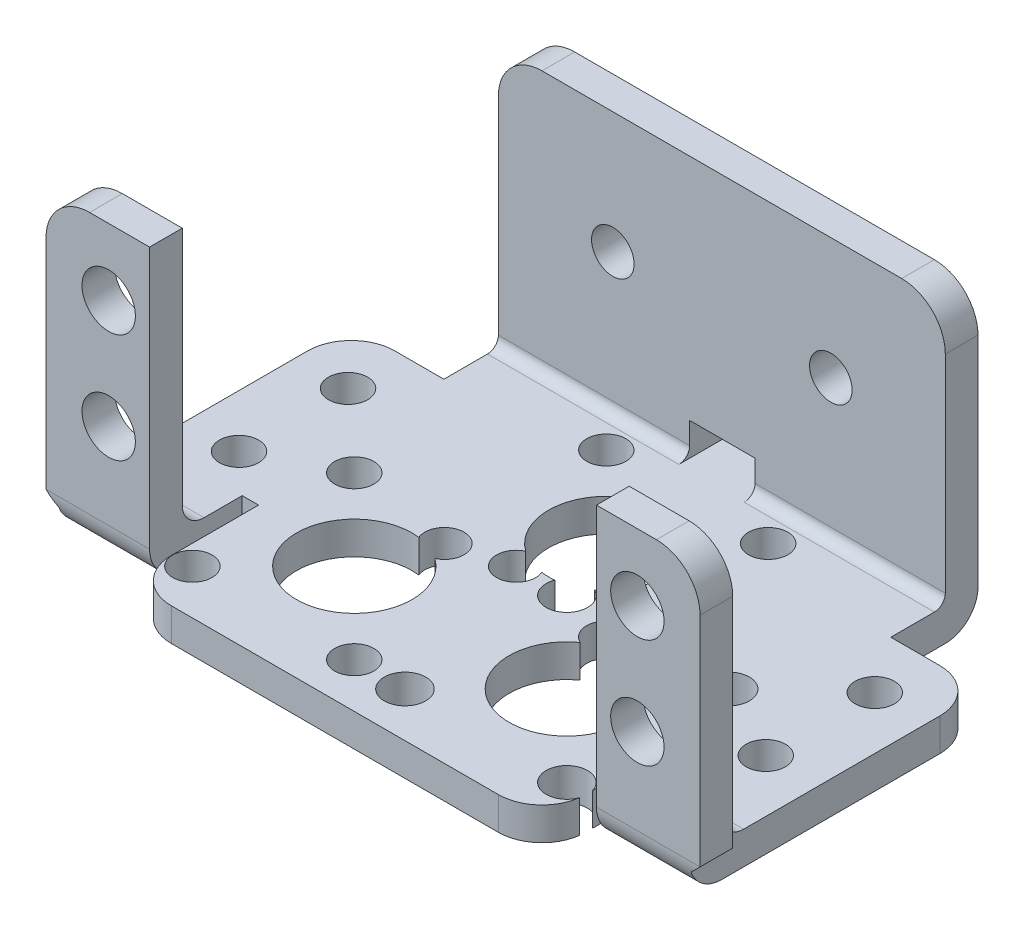
from build123d import *

# Parameters (mm, degrees)
CROQUIS1_W              = 41
CROQUIS1_H              = 23.5
CROQUIS1_R              = 5.3
SALIENTE_EXTRUIR1_DEPTH = 3
CROQUIS3_W              = 41
CROQUIS3_H              = 3
SALIENTE_EXTRUIR2_DEPTH = 27
CROQUIS4_R              = 1.8
SALIENTE_EXTRUIR3_DEPTH = 3
CROQUIS5_W              = 8.5
CROQUIS5_H              = 3
SALIENTE_EXTRUIR4_DEPTH = 27
CROQUIS6_W              = 38
CROQUIS6_H              = 3
SALIENTE_EXTRUIR5_DEPTH = 12
CORTAR_EXTRUIR3_REACH   = 54.868
CROQUIS10_R             = 2.45
CROQUIS16_W             = 3
CROQUIS16_H             = 24
SALIENTE_EXTRUIR6_DEPTH = 1
CROQUIS17_W             = 3
CROQUIS17_H             = 24
SALIENTE_EXTRUIR7_DEPTH = 1
CORTAR_EXTRUIR1_REACH   = 47.167
CROQUIS8_R              = 5.3
CORTAR_EXTRUIR2_REACH   = 57.779
CROQUIS9_R              = 1.95
REDONDEO1_R             = 4
REDONDEO2_R             = 3
REDONDEO3_R             = 1
REDONDEO4_R             = 2
CROQUIS11_R             = 1.8
CORTAR_EXTRUIR4_DEPTH   = 5
CROQUIS12_R             = 1.8
CORTAR_EXTRUIR5_DEPTH   = 5
CROQUIS14_R             = 1.9
CORTAR_EXTRUIR6_DEPTH   = 5
CROQUIS15_W             = 6
CROQUIS15_H             = 3
CORTAR_EXTRUIR7_DEPTH   = 6
CHAFL_N1_SIZE           = 1


with BuildPart() as part:
    # Croquis1 → Saliente-Extruir1 (new body)
    with BuildSketch(Plane(origin=(0, 0, 0), x_dir=(1, 0, 0), z_dir=(0, 1, 0))):
        Rectangle(CROQUIS1_W, CROQUIS1_H)
        with Locations(Location((0, 1.15, 0), (0, 0, 270))):
            Circle(CROQUIS1_R, mode=Mode.SUBTRACT)
    extrude(amount=SALIENTE_EXTRUIR1_DEPTH)

    # Croquis3 → Saliente-Extruir2 (add)
    with BuildSketch(Plane.XZ):
        with Locations((0, -13.25)):
            Rectangle(CROQUIS3_W, CROQUIS3_H)
    extrude(amount=-SALIENTE_EXTRUIR2_DEPTH)

    # Croquis4 → Saliente-Extruir3 (add)
    with BuildSketch(Plane.XZ):
        with BuildLine():
            Line((-20.5, -6.75), (-25, -6.75))
            ThreePointArc((-25, -6.75), (-27.828427125, -5.578427125), (-29, -2.75))
            Line((-29, -2.75), (-29, 17.25))
            Line((-29, 17.25), (-20.5, 17.25))
            Line((-20.5, 17.25), (-20.5, -6.75))
        make_face()
        with Locations(Location((-24.160816052, -1.62, 0), (0, 0, 270))):
            Circle(CROQUIS4_R, mode=Mode.SUBTRACT)
        with Locations(Location((-24.160816052, 8.38, 0), (0, 0, 270))):
            Circle(CROQUIS4_R, mode=Mode.SUBTRACT)
    saliente_extruir3 = extrude(amount=-SALIENTE_EXTRUIR3_DEPTH)

    # Croquis5 → Saliente-Extruir4 (add)
    with BuildSketch(Plane.XZ):
        with Locations((-24.75, 18.75)):
            Rectangle(CROQUIS5_W, CROQUIS5_H)
    saliente_extruir4 = extrude(amount=-SALIENTE_EXTRUIR4_DEPTH)

    # Croquis6 → Saliente-Extruir5 (add)
    with BuildSketch(Plane.XY.offset(11.75)):
        with Locations((0, 1.5)):
            Rectangle(CROQUIS6_W, CROQUIS6_H)
    extrude(amount=SALIENTE_EXTRUIR5_DEPTH)

    # Croquis10 → Cortar-Extruir3 (cut, up to next)
    with BuildSketch(Plane.XY.offset(20.25), mode=Mode.PRIVATE) as cortar_extruir3_sk1:
        with Locations((-24.25, 10.87)):
            Circle(CROQUIS10_R)
    cortar_extruir3_tool1 = extrude(cortar_extruir3_sk1.sketch, amount=-CORTAR_EXTRUIR3_REACH, mode=Mode.PRIVATE) & part.part
    # Croquis10 → Cortar-Extruir3 (cut, up to next)
    with BuildSketch(Plane.XY.offset(20.25), mode=Mode.PRIVATE) as cortar_extruir3_sk2:
        with Locations((-24.25, 20.87)):
            Circle(CROQUIS10_R)
    cortar_extruir3_tool2 = extrude(cortar_extruir3_sk2.sketch, amount=-CORTAR_EXTRUIR3_REACH, mode=Mode.PRIVATE) & part.part
    cortar_extruir3_1 = cortar_extruir3_tool1.solids().sort_by_distance((-24.25, 10.87, 20.25))[0]
    add(cortar_extruir3_1, mode=Mode.SUBTRACT)
    cortar_extruir3_2 = cortar_extruir3_tool2.solids().sort_by_distance((-24.25, 20.87, 20.25))[0]
    add(cortar_extruir3_2, mode=Mode.SUBTRACT)
    cortar_extruir3 = cortar_extruir3_1 + cortar_extruir3_2  # Cortar-Extruir3 as one shape, for the pattern or mirror that repeats it

    # Simetría3: Saliente-Extruir3, Saliente-Extruir4, Cortar-Extruir3 across plane
    add(saliente_extruir3.mirror(Plane(origin=(0, 0, 0), x_dir=(0, 0, 1), z_dir=(1, 0, 0))))
    add(saliente_extruir4.mirror(Plane(origin=(0, 0, 0), x_dir=(0, 0, 1), z_dir=(1, 0, 0))))
    add(cortar_extruir3.mirror(Plane(origin=(0, 0, 0), x_dir=(0, 0, 1), z_dir=(1, 0, 0))), mode=Mode.SUBTRACT)

    # Croquis16 → Saliente-Extruir6 (add)
    with BuildSketch(Plane(origin=(29, 0, 0), x_dir=(0, 0, -1), z_dir=(1, 0, 0))):
        with Locations((-18.75, 15)):
            Rectangle(CROQUIS16_W, CROQUIS16_H)
    extrude(amount=SALIENTE_EXTRUIR6_DEPTH)

    # Croquis17 → Saliente-Extruir7 (add)
    with BuildSketch(Plane.ZY.offset(29)):
        with Locations((18.75, 15)):
            Rectangle(CROQUIS17_W, CROQUIS17_H)
    extrude(amount=SALIENTE_EXTRUIR7_DEPTH)

    # Croquis8 → Cortar-Extruir1 (cut, up to next)
    with BuildSketch(Plane(origin=(0, 3, 0), x_dir=(1, 0, 0), z_dir=(0, 1, 0)), mode=Mode.PRIVATE) as cortar_extruir1_sk1:
        with Locations(Location((-9.75, -12.22, 0), (0, 0, 270))):
            Circle(CROQUIS8_R)
    cortar_extruir1_tool1 = extrude(cortar_extruir1_sk1.sketch, amount=-CORTAR_EXTRUIR1_REACH, mode=Mode.PRIVATE) & part.part
    cortar_extruir1 = cortar_extruir1_tool1.solids().sort_by_distance((-9.75, 3, 12.22))[0]
    add(cortar_extruir1, mode=Mode.SUBTRACT)

    # Simetría4: Cortar-Extruir1 across plane
    add(cortar_extruir1.mirror(Plane(origin=(0, 0, 0), x_dir=(0, 0, 1), z_dir=(1, 0, 0))), mode=Mode.SUBTRACT)

    # Croquis9 → Cortar-Extruir2 (cut, up to next)
    with BuildSketch(Plane(origin=(0, 0, -14.75), x_dir=(-1, 0, 0), z_dir=(0, 0, -1)), mode=Mode.PRIVATE) as cortar_extruir2_sk1:
        with Locations((-10, 15.87)):
            Circle(CROQUIS9_R)
    cortar_extruir2_tool1 = extrude(cortar_extruir2_sk1.sketch, amount=-CORTAR_EXTRUIR2_REACH, mode=Mode.PRIVATE) & part.part
    # Croquis9 → Cortar-Extruir2 (cut, up to next)
    with BuildSketch(Plane(origin=(0, 0, -14.75), x_dir=(-1, 0, 0), z_dir=(0, 0, -1)), mode=Mode.PRIVATE) as cortar_extruir2_sk2:
        with Locations((10, 15.87)):
            Circle(CROQUIS9_R)
    cortar_extruir2_tool2 = extrude(cortar_extruir2_sk2.sketch, amount=-CORTAR_EXTRUIR2_REACH, mode=Mode.PRIVATE) & part.part
    add(cortar_extruir2_tool1.solids().sort_by_distance((10, 15.87, -14.75))[0], mode=Mode.SUBTRACT)
    add(cortar_extruir2_tool2.solids().sort_by_distance((-10, 15.87, -14.75))[0], mode=Mode.SUBTRACT)

    # Redondeo1
    redondeo1_edges = [part.edges().sort_by_distance(p)[0] for p in [
        (-19, 1.5, 23.75),
        (19, 1.5, 23.75),
        (20.5, 27, -13.25),
        (-20.5, 27, -13.25),
        (-30, 27, 18.75),
        (30, 27, 18.75),
    ]]
    fillet(redondeo1_edges, radius=REDONDEO1_R)

    # Redondeo2
    redondeo2_edges = [part.edges().sort_by_distance(p)[0] for p in [
        (24.75, 0, 20.25),
        (0, 0, -14.75),
        (-24.75, 0, 20.25),
    ]]
    fillet(redondeo2_edges, radius=REDONDEO2_R)

    # Redondeo3
    redondeo3_edges = [part.edges().sort_by_distance(p)[0] for p in [
        (0, 3, -11.75),
    ]]
    fillet(redondeo3_edges, radius=REDONDEO3_R)

    # Redondeo4
    redondeo4_edges = [part.edges().sort_by_distance(p)[0] for p in [
        (24.75, 3, 17.25),
        (-24.75, 3, 17.25),
    ]]
    fillet(redondeo4_edges, radius=REDONDEO4_R)

    # Croquis11 → Cortar-Extruir4 (cut)
    with BuildSketch(Plane(origin=(0, 0, 0), x_dir=(1, 0, 0), z_dir=(0, 1, 0))):
        with Locations((7.424621202, -6.274621202)):
            Circle(CROQUIS11_R)
        with Locations((-7.424621202, -6.274621202)):
            Circle(CROQUIS11_R)
        with Locations(Location((-7.424621202, 8.574621202, 0), (0, 0, 270))):
            Circle(CROQUIS11_R)
        with Locations(Location((7.424621202, 8.574621202, 0), (0, 0, 270))):
            Circle(CROQUIS11_R)
    extrude(amount=CORTAR_EXTRUIR4_DEPTH, mode=Mode.SUBTRACT)

    # Croquis12 → Cortar-Extruir5 (cut)
    with BuildSketch(Plane.XZ):
        with Locations(Location((-2.325378798, 19.644621202, 0), (0, 0, 270))):
            Circle(CROQUIS12_R)
        with Locations((-2.325378798, 4.795378798)):
            Circle(CROQUIS12_R)
        with Locations(Location((-17.174621202, 4.795378798, 0), (0, 0, 270))):
            Circle(CROQUIS12_R)
        with Locations(Location((-17.174621202, 19.644621202, 0), (0, 0, 270))):
            Circle(CROQUIS12_R)
    extrude(amount=-CORTAR_EXTRUIR5_DEPTH, mode=Mode.SUBTRACT)

    # Croquis14 → Cortar-Extruir6 (cut)
    with BuildSketch(Plane.XZ):
        with Locations((17.174621202, 19.644621202)):
            Circle(CROQUIS14_R)
        with Locations(Location((17.174621202, 4.795378798, 0), (0, 0, 270))):
            Circle(CROQUIS14_R)
        with Locations((2.325378798, 4.795378798)):
            Circle(CROQUIS14_R)
        with Locations(Location((2.325378798, 19.644621202, 0), (0, 0, 270))):
            Circle(CROQUIS14_R)
    extrude(amount=-CORTAR_EXTRUIR6_DEPTH, mode=Mode.SUBTRACT)

    # Croquis15 → Cortar-Extruir7 (cut)
    with BuildSketch(Plane(origin=(0, 0, -14.75), x_dir=(-1, 0, 0), z_dir=(0, 0, -1))):
        with Locations((-0.0498677, 4.5)):
            Rectangle(CROQUIS15_W, CROQUIS15_H)
    extrude(amount=-CORTAR_EXTRUIR7_DEPTH, mode=Mode.SUBTRACT)

    # Chaflán1
    # the kernel refuses this chamfer: 1 mm, written as the material it adds along each edge
    with BuildSketch(Plane(origin=(29, 3, 22.821682988), x_dir=(-0.02749587661058563, -0.9996219169112968, 0), z_dir=(0, 0, -1))) as chafl_n1_piece_1_section:
        Polygon((CHAFL_N1_SIZE * 0.999621916911, -CHAFL_N1_SIZE * 0.0274958766106), (-CHAFL_N1_SIZE * 0.0274958766106, -CHAFL_N1_SIZE * 0.999621916911), (0, 0), align=None)
    chafl_n1_piece_1 = extrude(amount=5.571682988, mode=Mode.PRIVATE)
    chafl_n1_piece_1 = chafl_n1_piece_1 & Plane(origin=(29.334600076, 3, 17.25), x_dir=(0, -1, 0), z_dir=(1, 0, 0)) * Cylinder(3, 16, mode=Mode.PRIVATE)
    add(chafl_n1_piece_1)
    with BuildSketch(Plane(origin=(-29, 3, 22.821682988), x_dir=(0.02749587661058563, -0.9996219169112968, 0), z_dir=(0, 0, -1))) as chafl_n1_piece_2_section:
        Polygon((CHAFL_N1_SIZE * 0.999621916911, CHAFL_N1_SIZE * 0.0274958766106), (-CHAFL_N1_SIZE * 0.0274958766106, CHAFL_N1_SIZE * 0.999621916911), (0, 0), align=None)
    chafl_n1_piece_2 = extrude(amount=5.571682988, mode=Mode.PRIVATE)
    chafl_n1_piece_2 = chafl_n1_piece_2 & Plane(origin=(-29.334600076, 3, 17.25), x_dir=(0, -1, 0), z_dir=(-1, 0, 0)) * Cylinder(3, 16, mode=Mode.PRIVATE)
    add(chafl_n1_piece_2)


solid = part.part
